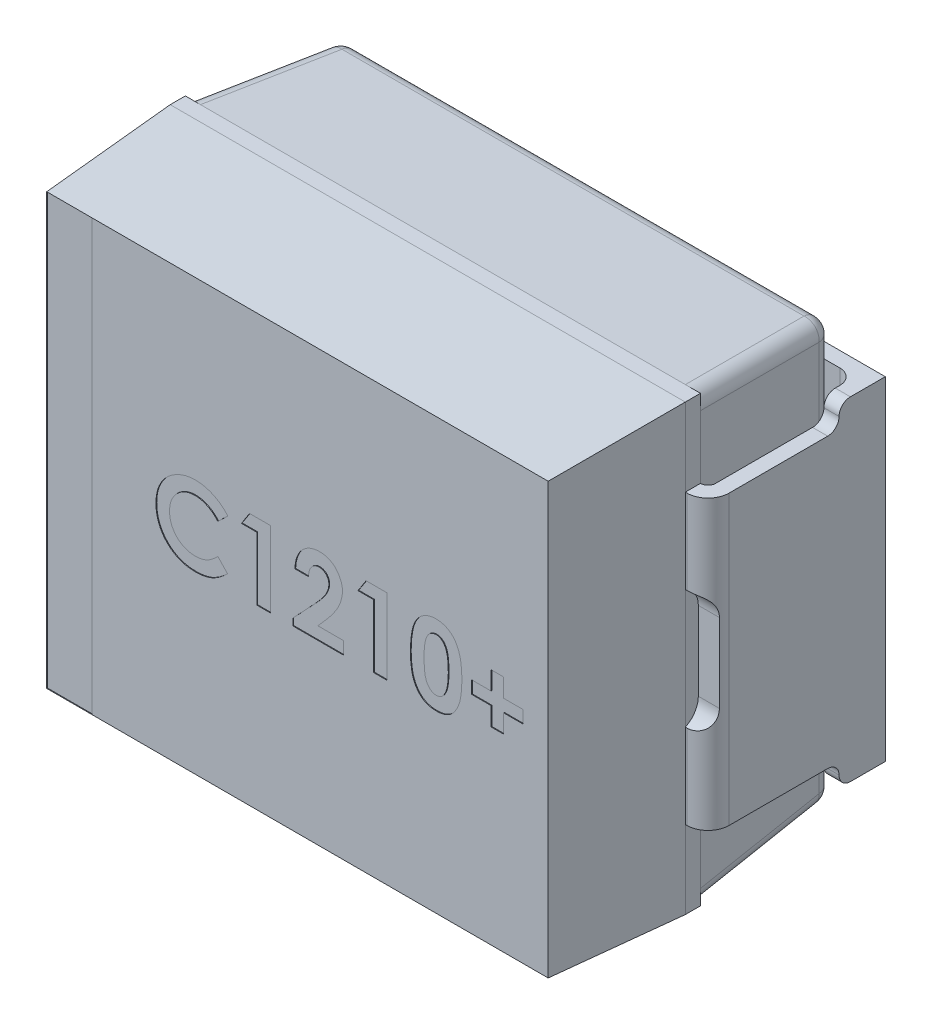
from build123d import *

# Parameters (mm, degrees)
BOSS_EXTRUDE1_START = 0.12
SKETCH1_W           = 3.4
SKETCH1_H           = 2.93
BOSS_EXTRUDE1_DEPTH = 0.95
CHAMFER3_SIZE       = 0.95
CHAMFER3_SIZE_2     = 0.08311423
FILLET4_R           = 0.1
SKETCH2_W           = 3.4
SKETCH2_H           = 2.93
BOSS_EXTRUDE2_DEPTH = 0.1
SKETCH3_W           = 3.4
SKETCH3_H           = 2.93
BOSS_EXTRUDE3_DEPTH = 0.86
BOSS_EXTRUDE3_TAPER = 3
BOSS_EXTRUDE4_START = 0.02
SKETCH4_W           = 1.4
SKETCH4_H           = 2.5
BOSS_EXTRUDE4_DEPTH = 0.1
FILLET5_R           = 0.1
BOSS_EXTRUDE5_DEPTH = 1.1
CUT_EXTRUDE3_DEPTH  = 0.15
CUT_EXTRUDE6_DEPTH  = 0.15
CUT_EXTRUDE7_DEPTH  = 0.005
SKETCH16_W          = 0.3
SKETCH16_H          = 2.83985862
CUT_EXTRUDE8_DEPTH  = 0.005


# Some blends are built 0.0001 mm under size
with BuildPart() as part:
    # Sketch1 → Boss-Extrude1 (new body)
    with BuildSketch(Plane.XY.offset(BOSS_EXTRUDE1_START)):
        Rectangle(SKETCH1_W, SKETCH1_H)
    extrude(amount=BOSS_EXTRUDE1_DEPTH)

    # Chamfer3
    # the kernel refuses this chamfer: 0.95, 0.08311423 mm, written as the material it takes off along each edge
    with BuildSketch(Plane(origin=(4.169652376, -1.465, 0.12), x_dir=(0, -0.0033526157940331914, 0.9999943799678764), z_dir=(-1, 0, 0)), Plane(origin=(-4.169652376, 1.465, 0.12), x_dir=(0, 0.0033526157940331914, 0.9999943799678764), z_dir=(1, 0, 0))) as chamfer3_piece_1:
        Polygon((CHAMFER3_SIZE * 0.999994379968, CHAMFER3_SIZE * 0.00335261579403), (-CHAMFER3_SIZE_2 * 0.00335261580814, CHAMFER3_SIZE_2 * 0.999994384174), (0, 0), align=None)
    extrude(amount=8.339304752, mode=Mode.SUBTRACT)
    with BuildSketch(Plane(origin=(1.7, 3.934652376, 0.12), x_dir=(0.0033526157940331914, 0, 0.9999943799678764), z_dir=(0, -1, 0)), Plane(origin=(-1.7, -3.934652376, 0.12), x_dir=(-0.0033526157940331914, 0, 0.9999943799678764), z_dir=(0, 1, 0))) as chamfer3_piece_2:
        Polygon((CHAMFER3_SIZE * 0.999994379968, CHAMFER3_SIZE * 0.00335261579403), (-CHAMFER3_SIZE_2 * 0.00335261580814, CHAMFER3_SIZE_2 * 0.999994384174), (0, 0), align=None)
    extrude(amount=7.869304752, mode=Mode.SUBTRACT)

    # Fillet4
    fillet4_edges = [part.edges().sort_by_distance(p)[0] for p in [
        (-1.61688577, 0, 0.12),
        (0, 1.38188577, 0.12),
        (1.61688577, 0, 0.12),
        (0, -1.38188577, 0.12),
        (-1.658442885, 1.423442885, 0.595),
        (1.658442885, 1.423442885, 0.595),
        (-1.658442885, -1.423442885, 0.595),
        (1.658442885, -1.423442885, 0.595),
    ]]
    fillet(fillet4_edges, radius=FILLET4_R)

    # Sketch2 → Boss-Extrude2 (add)
    with BuildSketch(Plane.XY.offset(1.07)):
        Rectangle(SKETCH2_W, SKETCH2_H)
    extrude(amount=BOSS_EXTRUDE2_DEPTH)

    # Sketch3 → Boss-Extrude3 (add)
    with BuildSketch(Plane.XY.offset(1.17)):
        Rectangle(SKETCH3_W, SKETCH3_H)
    extrude(amount=BOSS_EXTRUDE3_DEPTH, taper=BOSS_EXTRUDE3_TAPER)

    # Sketch4 → Boss-Extrude4 (add)
    with BuildSketch(Plane.XY.offset(BOSS_EXTRUDE4_START)):
        Rectangle(SKETCH4_W, SKETCH4_H)
    extrude(amount=BOSS_EXTRUDE4_DEPTH)

    # Fillet5
    fillet5_edges = [part.edges().sort_by_distance(p)[0] for p in [
        (0, -1.25, 0.02),
        (0.7, 0, 0.02),
        (0, 1.25, 0.02),
        (-0.7, 0, 0.02),
    ]]
    fillet(fillet5_edges, radius=FILLET5_R - 0.0001)  # a hair under: the kernel refuses the full size

    # Sketch6 → Boss-Extrude5 (add, symmetric)
    with BuildSketch(Plane(origin=(0, 0, 0), x_dir=(1, 0, 0), z_dir=(0, 1, 0))):
        with BuildLine():
            Line((-1.7, -1.17), (-1.7, -1.07))
            ThreePointArc((-1.7, -1.07), (-1.735648232, -1.055648232), (-1.75, -1.021))
            Line((-1.75, -1.021), (-1.75, -0.2))
            ThreePointArc((-1.75, -0.2), (-1.720710678, -0.129289322), (-1.65, -0.1))
            Line((-1.65, -0.1), (-1.15, -0.1))
            Line((-1.15, -0.1), (-1.15, 0))
            Line((-1.15, 0), (-1.85, 0))
            Line((-1.85, 0), (-1.85, -1.03))
            ThreePointArc((-1.85, -1.03), (-1.808994949, -1.128994949), (-1.71, -1.17))
            Line((-1.71, -1.17), (-1.7, -1.17))
        make_face()
        with BuildLine():
            Line((1.71, -1.17), (1.7, -1.17))
            Line((1.7, -1.17), (1.7, -1.07))
            ThreePointArc((1.7, -1.07), (1.735648232, -1.055648232), (1.75, -1.021))
            Line((1.75, -1.021), (1.75, -0.2))
            ThreePointArc((1.75, -0.2), (1.720710678, -0.129289322), (1.65, -0.1))
            Line((1.65, -0.1), (1.15, -0.1))
            Line((1.15, -0.1), (1.15, 0))
            Line((1.15, 0), (1.85, 0))
            Line((1.85, 0), (1.85, -1.03))
            ThreePointArc((1.85, -1.03), (1.808994949, -1.128994949), (1.71, -1.17))
        make_face()
    extrude(amount=BOSS_EXTRUDE5_DEPTH, both=True)

    # Sketch7 → Cut-Extrude3 (cut)
    with BuildSketch(Plane.ZY.offset(1.85)):
        with BuildLine():
            Line((1.17, 0.475), (0.559, 0.475))
            ThreePointArc((0.559, 0.475), (0.488289322, 0.445710678), (0.459, 0.375))
            Line((0.459, 0.375), (0.459, -0.375))
            ThreePointArc((0.459, -0.375), (0.488289322, -0.445710678), (0.559, -0.475))
            Line((0.559, -0.475), (1.17, -0.475))
            Line((1.17, -0.475), (1.17, 0.475))
        make_face()
    extrude(amount=-CUT_EXTRUDE3_DEPTH, mode=Mode.SUBTRACT)

    # Sketch11 → Cut-Extrude6 (cut)
    with BuildSketch(Plane(origin=(1.7, 0, -3.478843465), x_dir=(0, 0, 1), z_dir=(-1, 0, 0))):
        with BuildLine():
            Line((4.648843465, -1.1), (3.708843465, -1.1))
            ThreePointArc((3.708843465, -1.1), (3.761876473, -1.078033009), (3.783843465, -1.025))
            ThreePointArc((3.783843465, -1.025), (3.805810456, -0.971966991), (3.858843465, -0.95))
            Line((3.858843465, -0.95), (4.648843465, -0.95))
            Line((4.648843465, -0.95), (4.648843465, -1.1))
        make_face()
        with BuildLine():
            Line((4.64771858, 0.392975458), (4.648843465, 0.3935))
            Line((4.648843465, 0.3935), (4.648843465, -0.3935))
            Line((4.648843465, -0.3935), (4.64771858, -0.392975458))
            ThreePointArc((4.64771858, -0.392975458), (4.585864922, -0.338731255), (4.562843465, -0.259748213))
            Line((4.562843465, -0.259748213), (4.562843465, 0.259748213))
            ThreePointArc((4.562843465, 0.259748213), (4.585864922, 0.338731255), (4.64771858, 0.392975458))
        make_face()
        with BuildLine():
            Line((3.858843465, 0.95), (4.648843465, 0.95))
            Line((4.648843465, 0.95), (4.648843465, 1.1))
            Line((4.648843465, 1.1), (3.708843465, 1.1))
            ThreePointArc((3.708843465, 1.1), (3.761876473, 1.078033009), (3.783843465, 1.025))
            ThreePointArc((3.783843465, 1.025), (3.805810456, 0.971966991), (3.858843465, 0.95))
        make_face()
    extrude(amount=-CUT_EXTRUDE6_DEPTH, mode=Mode.SUBTRACT)

    # Sketch15 → Cut-Extrude7 (cut)
    # profile 1 of 6: a face of its own
    with BuildSketch(Plane.XY.offset(2.03)):
        with BuildLine():
            Line((-0.459468501, 0.163261218), (-0.52527379, 0.100360577))
            add(Edge.make_bspline(
                [(-0.52527379, 0.100360577), (-0.530855931, 0.10613252), (-0.5417596, 0.117406932), (-0.559329515, 0.132333261), (-0.577601587, 0.144772336), (-0.596220369, 0.155248446), (-0.615520759, 0.16317437), (-0.635279592, 0.168950125), (-0.655623035, 0.172471384), (-0.669390694, 0.172874278), (-0.676315457, 0.173076923)],
                knots=[0, 0, 0, 0, 1.115251505, 2.178435587, 3.19620269, 4.182487026, 5.141301733, 6.088180966, 7.038406374, 8, 8, 8, 8], degree=3))
            add(Edge.make_bspline(
                [(-0.676315457, 0.173076923), (-0.682098475, 0.172916826), (-0.693510625, 0.172600893), (-0.710266651, 0.170284792), (-0.726294656, 0.166346161), (-0.741649507, 0.160917997), (-0.75628602, 0.153894241), (-0.770234884, 0.14528033), (-0.783461707, 0.135154059), (-0.795791772, 0.123567822), (-0.807070882, 0.110908987), (-0.817036693, 0.09740204), (-0.825384659, 0.083077925), (-0.832235699, 0.068081707), (-0.837572394, 0.052343974), (-0.841383465, 0.035875323), (-0.843587686, 0.01865614), (-0.843916681, 0.006950668), (-0.844083886, 0.001001603)],
                knots=[0, 0, 0, 0, 1.035432265, 2.043311493, 3.022114605, 3.98653278, 4.95457646, 5.923598177, 6.917315552, 7.932509744, 8.948865224, 9.949768934, 10.933144597, 11.912367597, 12.897413939, 13.903909035, 14.934704909, 16, 16, 16, 16], degree=3))
            add(Edge.make_bspline(
                [(-0.844083886, 0.001001603), (-0.8440357, -0.003173868), (-0.843940723, -0.011403805), (-0.842901036, -0.023578167), (-0.841226894, -0.035390177), (-0.838803996, -0.046821941), (-0.835774138, -0.057883368), (-0.832219425, -0.068669883), (-0.82776009, -0.079032441), (-0.822810161, -0.089091397), (-0.81705345, -0.098572279), (-0.810846654, -0.107613087), (-0.804116397, -0.116169504), (-0.796819087, -0.12420655), (-0.788852024, -0.131598625), (-0.780421125, -0.138568018), (-0.771384174, -0.14494026), (-0.761928892, -0.15087527), (-0.751973596, -0.156031064), (-0.741788397, -0.160701217), (-0.731218866, -0.164494076), (-0.720393694, -0.167551466), (-0.709351567, -0.17015132), (-0.697984482, -0.17175213), (-0.686390977, -0.172964405), (-0.678555713, -0.173039255), (-0.674612732, -0.173076923)],
                knots=[0, 0, 0, 0, 1.103660481, 2.175337485, 3.227646561, 4.255952547, 5.262355991, 6.258840057, 7.255597736, 8.242457506, 9.22035537, 10.185017736, 11.140346927, 12.096287581, 13.051739095, 14.01125915, 14.986044842, 15.97314143, 16.960198552, 17.947847494, 18.933482797, 19.925264591, 20.920966487, 21.929612487, 22.958107872, 24, 24, 24, 24], degree=3))
            add(Edge.make_bspline(
                [(-0.674612732, -0.173076923), (-0.667924758, -0.172883471), (-0.654784629, -0.172503389), (-0.6354996, -0.1695312), (-0.617122888, -0.164642116), (-0.602439983, -0.158868392), (-0.590936315, -0.153166765), (-0.582178743, -0.147893041), (-0.57312273, -0.141993801), (-0.56391869, -0.135246402), (-0.554463096, -0.127731816), (-0.54492286, -0.119285459), (-0.535053751, -0.110185457), (-0.528588595, -0.103690607), (-0.52527379, -0.100360577)],
                knots=[0, 0, 0, 0, 1.404581149, 2.759636711, 4.088442092, 5.392261763, 6.066678138, 6.783632037, 7.538459478, 8.336747902, 9.180226004, 10.074962426, 11.012997595, 12, 12, 12, 12], degree=3))
            Line((-0.52527379, -0.100360577), (-0.461471707, -0.167367788))
            add(Edge.make_bspline(
                [(-0.461471707, -0.167367788), (-0.46595665, -0.17169786), (-0.474710299, -0.180149234), (-0.487914937, -0.192149396), (-0.501102956, -0.202932876), (-0.513955761, -0.212891067), (-0.526683895, -0.221733862), (-0.539286008, -0.229470092), (-0.551619439, -0.236295419), (-0.563940294, -0.242094736), (-0.576325242, -0.247018958), (-0.589067898, -0.251258391), (-0.602207217, -0.254844798), (-0.615823448, -0.257738558), (-0.629789589, -0.260058962), (-0.644236342, -0.261625222), (-0.659072109, -0.262678166), (-0.669135439, -0.262772782), (-0.674212091, -0.262820513)],
                knots=[0, 0, 0, 0, 1.244526981, 2.429050516, 3.560637417, 4.644440555, 5.67424972, 6.652764056, 7.595344123, 8.486817594, 9.369275933, 10.254498637, 11.166417451, 12.086725134, 13.032340136, 13.991389299, 14.986715468, 16, 16, 16, 16], degree=3))
            add(Edge.make_bspline(
                [(-0.674212091, -0.262820513), (-0.683537272, -0.262582795), (-0.701784058, -0.262117648), (-0.728524248, -0.258671224), (-0.75392671, -0.252893355), (-0.778053244, -0.244721854), (-0.800896179, -0.234283145), (-0.822449671, -0.221485777), (-0.842678979, -0.206363752), (-0.861420692, -0.189094314), (-0.878373463, -0.170021669), (-0.893357749, -0.149542882), (-0.905752752, -0.127557305), (-0.916044589, -0.104389736), (-0.924092671, -0.079934453), (-0.929757156, -0.054165003), (-0.933250402, -0.027106266), (-0.933632569, -0.008624526), (-0.933827476, 0.000801282)],
                knots=[0, 0, 0, 0, 1.078019885, 2.10938526, 3.111377082, 4.085535484, 5.04941344, 6.010039228, 6.978205633, 7.964457913, 8.951525778, 9.924444315, 10.892603023, 11.863865945, 12.85144698, 13.863884204, 14.910567087, 16, 16, 16, 16], degree=3))
            add(Edge.make_bspline(
                [(-0.933827476, 0.000801282), (-0.933745117, 0.006948713), (-0.933581903, 0.01913142), (-0.931866508, 0.037077533), (-0.929475147, 0.054571784), (-0.925681471, 0.071432523), (-0.921108568, 0.087886897), (-0.915421562, 0.103756064), (-0.908629537, 0.119085636), (-0.900951415, 0.133901274), (-0.892265232, 0.14810592), (-0.882561813, 0.161577534), (-0.87209096, 0.174420114), (-0.860601077, 0.18646328), (-0.848259126, 0.197812772), (-0.835009385, 0.208407087), (-0.820931544, 0.218398158), (-0.805987501, 0.227528339), (-0.790467578, 0.235787073), (-0.774567522, 0.24307163), (-0.758326397, 0.249159842), (-0.741812873, 0.254209789), (-0.72495718, 0.257979217), (-0.70787963, 0.260832553), (-0.690434913, 0.262427586), (-0.678722298, 0.262688703), (-0.672809848, 0.262820513)],
                knots=[0, 0, 0, 0, 1.071919942, 2.124283339, 3.142214191, 4.149696895, 5.136002878, 6.119640489, 7.086990633, 8.058538607, 9.028339693, 9.988281803, 10.952401235, 11.916291999, 12.888973767, 13.874849856, 14.873389453, 15.898127285, 16.927174885, 17.938320013, 18.946391617, 19.950418109, 20.947802303, 21.956882652, 22.968648068, 24, 24, 24, 24], degree=3))
            add(Edge.make_bspline(
                [(-0.672809848, 0.262820513), (-0.667765922, 0.262744956), (-0.657730512, 0.262594628), (-0.642786104, 0.261341479), (-0.627961214, 0.259373422), (-0.61330892, 0.256404043), (-0.598724414, 0.252879014), (-0.584399352, 0.248263476), (-0.57010775, 0.243118588), (-0.556073749, 0.236968926), (-0.54227776, 0.230256014), (-0.529042976, 0.222639971), (-0.516147186, 0.214589481), (-0.503876154, 0.205628079), (-0.492000015, 0.196080814), (-0.480580872, 0.185903141), (-0.469718935, 0.174925368), (-0.462902586, 0.167168924), (-0.459468501, 0.163261218)],
                knots=[0, 0, 0, 0, 0.996412454, 1.982464992, 2.961075852, 3.949442424, 4.934965278, 5.923860011, 6.921385422, 7.934793307, 8.949617135, 9.951082467, 10.950285876, 11.951772932, 12.951063433, 13.960125323, 14.972308753, 16, 16, 16, 16], degree=3))
        make_face()
    # profile 2 of 6: a face of its own
    with BuildSketch(Plane.XY.offset(2.03)):
        Polygon((-0.316139175, 0.25), (-0.177417219, 0.25), (-0.177417219, -0.25), (-0.267160809, -0.25), (-0.267160809, 0.166666667), (-0.369724912, 0.166666667), align=None)
    # profile 3 of 6: a face of its own
    with BuildSketch(Plane.XY.offset(2.03)):
        with BuildLine():
            Line((0.072582781, 0.083333333), (-0.017160809, 0.083333333))
            add(Edge.make_bspline(
                [(-0.017160809, 0.083333333), (-0.01677322, 0.090121961), (-0.016015895, 0.103386532), (-0.013003447, 0.122653746), (-0.008966869, 0.140859145), (-0.003579521, 0.157939044), (0.003190035, 0.173887237), (0.0111676, 0.188758091), (0.020556984, 0.202473312), (0.031158348, 0.214966758), (0.042791711, 0.226174743), (0.055215553, 0.236112446), (0.068619913, 0.244312789), (0.082759884, 0.251060912), (0.097633056, 0.256452349), (0.113380154, 0.260056961), (0.12986483, 0.262498039), (0.141149926, 0.262711643), (0.146901691, 0.262820513)],
                knots=[0, 0, 0, 0, 1.199038563, 2.342849363, 3.436047546, 4.486744587, 5.497670872, 6.488682221, 7.459191391, 8.424610317, 9.374430501, 10.305433194, 11.225809216, 12.140057399, 13.06607119, 14.010487599, 14.985989317, 16, 16, 16, 16], degree=3))
            add(Edge.make_bspline(
                [(0.146901691, 0.262820513), (0.153961901, 0.262600216), (0.167745085, 0.262170144), (0.187773145, 0.25850149), (0.206477164, 0.252365099), (0.223843544, 0.243790942), (0.239724444, 0.232898375), (0.254117229, 0.219910771), (0.266586639, 0.204555644), (0.277211734, 0.187471895), (0.286039918, 0.16938261), (0.292226341, 0.150677539), (0.296292611, 0.131853039), (0.296726303, 0.119177573), (0.296941755, 0.112880609)],
                knots=[0, 0, 0, 0, 1.075374347, 2.099382735, 3.09057751, 4.06680945, 5.040638231, 6.016817125, 7.011024321, 8.044445721, 9.0776792, 10.070479129, 11.0414456, 12, 12, 12, 12], degree=3))
            add(Edge.make_bspline(
                [(0.296941755, 0.112880609), (0.29685787, 0.10907176), (0.296689029, 0.101405488), (0.295515057, 0.089804537), (0.293753868, 0.077987612), (0.291098424, 0.065964846), (0.287786867, 0.053732866), (0.28376947, 0.041255069), (0.278953046, 0.028602198), (0.27341797, 0.015631847), (0.26681461, 0.002301907), (0.259125916, -0.011587443), (0.250147811, -0.026023883), (0.239988741, -0.041088924), (0.228599364, -0.056758809), (0.215924082, -0.072986332), (0.202108884, -0.089828676), (0.19230385, -0.101086838), (0.187266274, -0.106870994)],
                knots=[0, 0, 0, 0, 0.728284026, 1.46585585, 2.227944881, 3.01186502, 3.81876927, 4.650621989, 5.517437689, 6.406905708, 7.346299482, 8.360816762, 9.441613733, 10.596154504, 11.834900912, 13.145207542, 14.533280747, 16, 16, 16, 16], degree=3))
            Line((0.187266274, -0.106870994), (0.135082781, -0.166666667))
            Line((0.135082781, -0.166666667), (0.303352011, -0.166666667))
            Line((0.303352011, -0.166666667), (0.303352011, -0.25))
            Line((0.303352011, -0.25), (-0.029981322, -0.25))
            Line((-0.029981322, -0.25), (-0.029981322, -0.204527244))
            Line((-0.029981322, -0.204527244), (0.118055537, -0.04697516))
            add(Edge.make_bspline(
                [(0.118055537, -0.04697516), (0.122341585, -0.042379317), (0.130642387, -0.033478532), (0.142453575, -0.020406781), (0.153141656, -0.008002003), (0.162485004, 0.003867891), (0.170973948, 0.014817888), (0.178229965, 0.025178035), (0.184319442, 0.034854673), (0.190930434, 0.046523008), (0.197208702, 0.060439575), (0.202969394, 0.076472029), (0.206480934, 0.091795364), (0.206965637, 0.101780378), (0.207198165, 0.106570513)],
                knots=[0, 0, 0, 0, 1.246127091, 2.413378631, 3.493388633, 4.492180848, 5.408488754, 6.240484944, 6.999099869, 7.674939598, 8.898438119, 10.020720584, 11.050475521, 12, 12, 12, 12], degree=3))
            add(Edge.make_bspline(
                [(0.207198165, 0.106570513), (0.20702431, 0.111204599), (0.206687437, 0.120183883), (0.202985475, 0.132956868), (0.197250267, 0.144521501), (0.189168549, 0.154532219), (0.179379058, 0.16275869), (0.168066381, 0.168877308), (0.15532275, 0.172407723), (0.146389222, 0.172849604), (0.141793518, 0.173076923)],
                knots=[0, 0, 0, 0, 1.062038974, 2.057870785, 3.028805853, 4.01125022, 4.991535629, 5.949134679, 6.94496649, 8, 8, 8, 8], degree=3))
            add(Edge.make_bspline(
                [(0.141793518, 0.173076923), (0.139419318, 0.172992949), (0.134745325, 0.172827632), (0.127874921, 0.171727163), (0.121337237, 0.1697877), (0.115059506, 0.167189094), (0.109108726, 0.163744623), (0.103499907, 0.159498763), (0.098173951, 0.154559411), (0.093155287, 0.148942013), (0.088587648, 0.142672995), (0.084530687, 0.135809612), (0.081176256, 0.128356124), (0.078222893, 0.120410929), (0.075945118, 0.111888688), (0.074286615, 0.102840407), (0.073025766, 0.093280805), (0.072733129, 0.086709478), (0.072582781, 0.083333333)],
                knots=[0, 0, 0, 0, 0.903469896, 1.778625579, 2.63899355, 3.493148037, 4.358286772, 5.247621495, 6.164656832, 7.118446693, 8.109501108, 9.111810964, 10.146451449, 11.215617525, 12.33435995, 13.498009769, 14.714554818, 16, 16, 16, 16], degree=3))
        make_face()
    # profile 4 of 6: a face of its own
    with BuildSketch(Plane.XY.offset(2.03)):
        Polygon((0.453091595, 0.25), (0.59181355, 0.25), (0.59181355, -0.25), (0.50206996, -0.25), (0.50206996, 0.166666667), (0.399505858, 0.166666667), align=None)
    # profile 5 of 6: a face of its own
    with BuildSketch(Plane.XY.offset(2.03)):
        with BuildLine():
            add(Edge.make_bspline(
                [(0.914029095, 0.262820513), (0.918373057, 0.262756025), (0.926914447, 0.262629226), (0.939494307, 0.261255886), (0.951612191, 0.259181152), (0.963315504, 0.256287621), (0.974520006, 0.252458137), (0.985307245, 0.247874309), (0.995548821, 0.242295708), (1.005375348, 0.235994391), (1.01478304, 0.228860407), (1.02354579, 0.220727297), (1.031823625, 0.211782204), (1.039437359, 0.201889895), (1.046555602, 0.19114035), (1.053154963, 0.179531864), (1.059184923, 0.167007623), (1.064713065, 0.153545025), (1.069656346, 0.138942271), (1.073820066, 0.123031862), (1.077391152, 0.105810165), (1.080405401, 0.087234311), (1.082683686, 0.067279609), (1.084219296, 0.045959316), (1.085273104, 0.023314535), (1.085359108, 0.007780401), (1.085403293, -0.000200321)],
                knots=[0, 0, 0, 0, 0.879237366, 1.728815576, 2.559023295, 3.367336655, 4.166867292, 4.954216142, 5.737608147, 6.525189134, 7.316157332, 8.124696809, 8.942788509, 9.781158001, 10.649253743, 11.551476218, 12.482711956, 13.461909668, 14.496590415, 15.601789533, 16.789733467, 18.056700938, 19.410929216, 20.8549011, 22.384193279, 24, 24, 24, 24], degree=3))
            add(Edge.make_bspline(
                [(1.085403293, -0.000200321), (1.085355541, -0.00828089), (1.08526276, -0.023981291), (1.084263103, -0.046833193), (1.082541646, -0.068308284), (1.080322909, -0.088404342), (1.077283846, -0.107110754), (1.073724681, -0.124475959), (1.069495238, -0.14049366), (1.064389127, -0.155127768), (1.058894448, -0.168614009), (1.052847992, -0.181113831), (1.04635515, -0.19266109), (1.039564848, -0.203429992), (1.032104814, -0.213103076), (1.024338152, -0.222009276), (1.015926686, -0.229809344), (1.007224571, -0.236905261), (0.997913015, -0.243037557), (0.988088044, -0.248400762), (0.977574496, -0.252750958), (0.966564016, -0.256534527), (0.954868927, -0.259250721), (0.942675063, -0.261405931), (0.929844758, -0.262597033), (0.92110937, -0.262744797), (0.916633261, -0.262820513)],
                knots=[0, 0, 0, 0, 1.643780988, 3.193836972, 4.651895693, 6.025988579, 7.305620092, 8.505800249, 9.631074763, 10.672816429, 11.65661981, 12.592235626, 13.49536222, 14.350718032, 15.179365177, 15.97804903, 16.751647189, 17.51006938, 18.259804725, 19.016521909, 19.783502495, 20.571750527, 21.382245291, 22.22305063, 23.089471752, 24, 24, 24, 24], degree=3))
            add(Edge.make_bspline(
                [(0.916633261, -0.262820513), (0.912157274, -0.262743336), (0.90338888, -0.262592149), (0.890523881, -0.261414788), (0.878265395, -0.25924199), (0.86647778, -0.256513674), (0.855243074, -0.25275933), (0.844507407, -0.248278979), (0.834353327, -0.242949237), (0.82475272, -0.236802654), (0.815738364, -0.229754214), (0.807170177, -0.221879309), (0.799067111, -0.2131979), (0.791552435, -0.203612748), (0.78450308, -0.193251794), (0.777992559, -0.181996723), (0.772024785, -0.16986392), (0.766413086, -0.156836474), (0.761537229, -0.142633919), (0.757197943, -0.127129427), (0.753643314, -0.110193757), (0.750784444, -0.091832349), (0.748501923, -0.072084102), (0.74680399, -0.050939485), (0.745798781, -0.028388648), (0.745706972, -0.012888335), (0.745659704, -0.004907853)],
                knots=[0, 0, 0, 0, 0.917216111, 1.796812873, 2.643793957, 3.46689424, 4.273913431, 5.068098542, 5.848489301, 6.620921603, 7.401012384, 8.190319798, 9.003608147, 9.831726257, 10.68377682, 11.569763213, 12.493818149, 13.453288342, 14.474581811, 15.568529029, 16.750744269, 18.018426408, 19.375425659, 20.823733699, 22.36466933, 24, 24, 24, 24], degree=3))
            add(Edge.make_bspline(
                [(0.745659704, -0.004907853), (0.745745326, 0.0061804), (0.745910536, 0.027575325), (0.748004196, 0.058484772), (0.751077158, 0.087055201), (0.755590611, 0.113238821), (0.761171434, 0.137132609), (0.768317967, 0.158579165), (0.776453776, 0.17787525), (0.78338653, 0.189306367), (0.786725409, 0.194811699)],
                knots=[0, 0, 0, 0, 1.288568992, 2.486310467, 3.599230591, 4.627010532, 5.572937695, 6.447898582, 7.252493626, 8, 8, 8, 8], degree=3))
            add(Edge.make_bspline(
                [(0.786725409, 0.194811699), (0.790607698, 0.200220135), (0.798198337, 0.210794693), (0.811470783, 0.224677111), (0.825730298, 0.236550034), (0.841269764, 0.246144769), (0.857843419, 0.253711177), (0.875593555, 0.259055246), (0.894454625, 0.26216895), (0.907406836, 0.262600082), (0.914029095, 0.262820513)],
                knots=[0, 0, 0, 0, 1.058512271, 2.069600068, 3.047294572, 4.004278952, 4.967380941, 5.939006123, 6.946246673, 8, 8, 8, 8], degree=3))
        make_face()
        with BuildLine():
            add(Edge.make_bspline(
                [(0.91623262, 0.173076923), (0.912305642, 0.172890792), (0.904606681, 0.172525877), (0.893435122, 0.169428259), (0.882901039, 0.164643822), (0.874888043, 0.1588865), (0.868890395, 0.153367417), (0.864699796, 0.148372826), (0.860658623, 0.142799222), (0.857089256, 0.136395098), (0.853718842, 0.129390561), (0.850424931, 0.121753814), (0.847724789, 0.113297283), (0.845071972, 0.104164984), (0.842747856, 0.094104432), (0.840800756, 0.083033394), (0.839061194, 0.070879873), (0.837847828, 0.05763591), (0.836716607, 0.043315361), (0.835905695, 0.027886324), (0.835566673, 0.011352963), (0.835458908, -3.3317e-05), (0.835403293, -0.005909455)],
                knots=[0, 0, 0, 0, 1.076674018, 2.110852608, 3.161083442, 4.239746716, 4.804137807, 5.395870207, 6.026861976, 6.692161227, 7.405688833, 8.16177676, 8.973626916, 9.841385931, 10.773283133, 11.807421078, 12.927755683, 14.143907515, 15.458935494, 16.872852025, 18.386167141, 20, 20, 20, 20], degree=3))
            add(Edge.make_bspline(
                [(0.835403293, -0.005909455), (0.835494828, -0.013522276), (0.835670352, -0.028120425), (0.836589666, -0.049113071), (0.838432355, -0.068218069), (0.840724288, -0.085564902), (0.843943402, -0.101041069), (0.8476472, -0.11479299), (0.852221062, -0.126645361), (0.857507041, -0.136769595), (0.8633615, -0.14538226), (0.869716773, -0.152703064), (0.876356486, -0.159042534), (0.883487885, -0.164192008), (0.891093958, -0.168138327), (0.899111207, -0.170976866), (0.907544727, -0.172714454), (0.913319915, -0.172955402), (0.91623262, -0.173076923)],
                knots=[0, 0, 0, 0, 1.771748488, 3.397459088, 4.888034009, 6.237357457, 7.467047327, 8.564189669, 9.548206622, 10.417051504, 11.216568818, 11.965764335, 12.669334354, 13.348544111, 14.005342236, 14.656555988, 15.322436492, 16, 16, 16, 16], degree=3))
            add(Edge.make_bspline(
                [(0.91623262, -0.173076923), (0.919045371, -0.172993769), (0.924552387, -0.172830964), (0.932582849, -0.17115979), (0.940177024, -0.168442825), (0.947311984, -0.164599486), (0.954013249, -0.159712094), (0.960248068, -0.153759169), (0.965969418, -0.146681376), (0.969302702, -0.141428607), (0.971020281, -0.138721955)],
                knots=[0, 0, 0, 0, 0.992283464, 1.942767638, 2.88273346, 3.832339453, 4.79467288, 5.803907806, 6.868395428, 8, 8, 8, 8], degree=3))
            add(Edge.make_bspline(
                [(0.971020281, -0.138721955), (0.97304244, -0.135023402), (0.977282743, -0.127267835), (0.98218963, -0.114180605), (0.986319973, -0.099420372), (0.989874899, -0.082941202), (0.992306252, -0.064678099), (0.99440013, -0.044746869), (0.99541006, -0.023047149), (0.99557433, -0.008013504), (0.995659704, -0.000200321)],
                knots=[0, 0, 0, 0, 0.710965849, 1.490837728, 2.352621235, 3.297892224, 4.334225155, 5.461620853, 6.680770821, 8, 8, 8, 8], degree=3))
            add(Edge.make_bspline(
                [(0.995659704, -0.000200321), (0.995626726, 0.007680685), (0.995563249, 0.022850276), (0.994398631, 0.044628009), (0.992776811, 0.064518353), (0.990404557, 0.082476902), (0.987352221, 0.098547252), (0.983590205, 0.112728351), (0.979155068, 0.125048148), (0.973895525, 0.135494358), (0.968070254, 0.144372204), (0.96188655, 0.151988707), (0.955318268, 0.158491485), (0.94837639, 0.163905009), (0.940900246, 0.168041348), (0.933032638, 0.170961945), (0.924757439, 0.172728808), (0.919112581, 0.172959319), (0.91623262, 0.173076923)],
                knots=[0, 0, 0, 0, 1.793836731, 3.452829483, 4.963243077, 6.335886805, 7.574563692, 8.684454726, 9.672768357, 10.54971625, 11.340229787, 12.085688095, 12.778991901, 13.440269426, 14.083255152, 14.715733572, 15.344777694, 16, 16, 16, 16], degree=3))
        make_face(mode=Mode.SUBTRACT)
    # profile 6 of 6: a face of its own
    with BuildSketch(Plane.XY.offset(2.03)):
        Polygon((1.277710986, 0.032051282), (1.277710986, 0.153846154), (1.361044319, 0.153846154), (1.361044319, 0.032051282), (1.489249447, 0.032051282), (1.489249447, -0.051282051), (1.361044319, -0.051282051), (1.361044319, -0.173076923), (1.277710986, -0.173076923), (1.277710986, -0.051282051), (1.149505858, -0.051282051), (1.149505858, 0.032051282), align=None)
    extrude(amount=-CUT_EXTRUDE7_DEPTH, mode=Mode.SUBTRACT)

    # Sketch16 → Cut-Extrude8 (cut)
    with BuildSketch(Plane.XY.offset(2.03)):
        with Locations((-1.50492931, 0)):
            Rectangle(SKETCH16_W, SKETCH16_H)
    extrude(amount=-CUT_EXTRUDE8_DEPTH, mode=Mode.SUBTRACT)


solid = part.part
